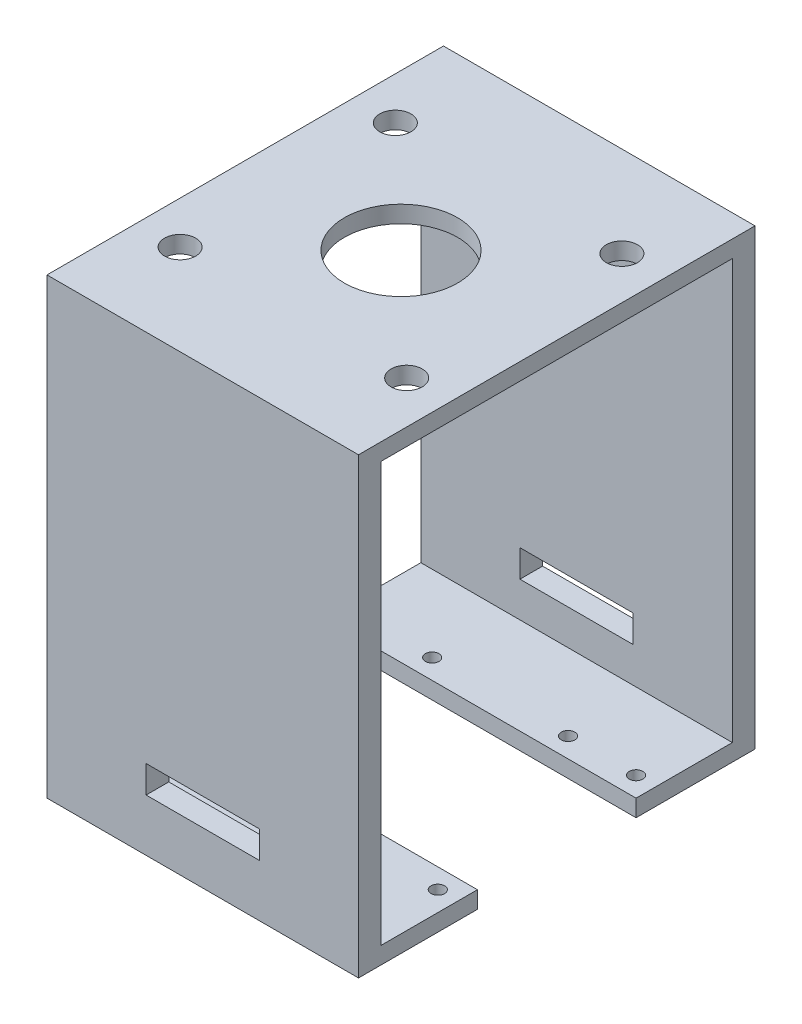
from build123d import *

# Parameters (mm, degrees)
SKETCH1_W                 = 75
SKETCH1_H                 = 40
SKETCH1_R                 = 5
SKETCH1_R_2               = 1.7
SKETCH1_W_2               = 10
SKETCH1_H_2               = 20
BOSS_EXTRUDE1_DEPTH       = 3
CUT_EXTRUDE1_DEPTH        = 43.605750786
CUT_EXTRUDE1_DEPTH_BACK   = 43.605750786
SKETCH2_W                 = 67
SKETCH2_H                 = 28
BOSS_EXTRUDE3_DEPTH       = 110
BOSS_EXTRUDE3_DEPTH_BACK  = 3
SKETCH3_W                 = 75
SKETCH3_H                 = 70
SKETCH3_W_2               = 67
SKETCH3_H_2               = 40
SKETCH6_W                 = 67
SKETCH6_H                 = 11
CUT_EXTRUDE4_DEPTH        = 122.372360939
SKETCH7_W                 = 70
SKETCH7_H                 = 37
BOSS_EXTRUDE4_DEPTH       = 45
SKETCH8_W                 = 45
SKETCH8_H                 = 62
CUT_EXTRUDE6_DEPTH        = 29
SKETCH11_W                = 45
SKETCH11_H                = 4
CUT_EXTRUDE9_DEPTH        = 157.445677473
SKETCH9_W                 = 38
SKETCH9_H                 = 28.5
CUT_EXTRUDE10_DEPTH       = 204.024629048
SKETCH13_W                = 5
SKETCH13_H                = 38
BOSS_EXTRUDE5_DEPTH       = 32
SKETCH14_R                = 5
SKETCH14_R_2              = 1.7
CUT_EXTRUDE11_DEPTH       = 32
SKETCH15_W                = 165
SKETCH15_H                = 70
SKETCH15_W_2              = 157
SKETCH15_H_2              = 62
BOSS_EXTRUDE6_DEPTH       = 3
SKETCH16_W                = 20
SKETCH16_H                = 4.820648258
CUT_EXTRUDE12_DEPTH       = 159.626132778
SKETCH18_R                = 5
CUT_EXTRUDE14_DEPTH       = 159.626132778
MIRROR6_COPY_1_SKETCH_W   = 5
MIRROR6_COPY_1_SKETCH_H   = 38
MIRROR6_COPY_1_DEPTH      = 32
MIRROR6_COPY_2_SKETCH_R   = 5
MIRROR6_COPY_2_SKETCH_R_2 = 1.7
MIRROR6_COPY_2_DEPTH      = 32
MIRROR6_COPY_3_SKETCH_W   = 5
MIRROR6_COPY_3_SKETCH_H   = 38
MIRROR6_COPY_3_DEPTH      = 32
MIRROR6_COPY_4_SKETCH_R   = 5
MIRROR6_COPY_4_SKETCH_R_2 = 1.7
MIRROR6_COPY_4_DEPTH      = 32
SKETCH19_W                = 38
SKETCH19_H                = 3.5
CUT_EXTRUDE15_DEPTH       = 10
SKETCH20_R                = 1.2
CUT_EXTRUDE16_DEPTH       = 10
SKETCH21_W                = 10
SKETCH21_H                = 80
CUT_EXTRUDE17_DEPTH       = 184.330984833
SKETCH22_W                = 172.739058827
SKETCH22_H                = 75.843231067
CUT_EXTRUDE18_DEPTH       = 184.330984833
SKETCH23_W                = 55
SKETCH23_H                = 70
BOSS_EXTRUDE7_DEPTH       = 3
SKETCH24_R                = 10
SKETCH24_R_2              = 2.75
CUT_EXTRUDE19_DEPTH       = 3


with BuildPart() as part:
    # Sketch1 → Boss-Extrude1 (new body)
    with BuildSketch(Plane(origin=(0, 0, 0), x_dir=(1, 0, 0), z_dir=(0, 1, 0))):
        Rectangle(SKETCH1_W, SKETCH1_H)
        with Locations((-21, 0)):
            Circle(SKETCH1_R, mode=Mode.SUBTRACT)
        with Locations((-30, 8.25)):
            Circle(SKETCH1_R_2, mode=Mode.SUBTRACT)
        with Locations((-12, 8.25)):
            Circle(SKETCH1_R_2, mode=Mode.SUBTRACT)
        with Locations((-12, -8.25)):
            Circle(SKETCH1_R_2, mode=Mode.SUBTRACT)
        with Locations((-30, -8.25)):
            Circle(SKETCH1_R_2, mode=Mode.SUBTRACT)
        with Locations((12, 8.25)):
            Circle(SKETCH1_R_2, mode=Mode.SUBTRACT)
        with Locations((12, -8.25)):
            Circle(SKETCH1_R_2, mode=Mode.SUBTRACT)
        with Locations((21, 0)):
            Circle(SKETCH1_R, mode=Mode.SUBTRACT)
        with Locations((30, -8.25)):
            Circle(SKETCH1_R_2, mode=Mode.SUBTRACT)
        with Locations((30, 8.25)):
            Circle(SKETCH1_R_2, mode=Mode.SUBTRACT)
        Rectangle(SKETCH1_W_2, SKETCH1_H_2, mode=Mode.SUBTRACT)
    extrude(amount=BOSS_EXTRUDE1_DEPTH)

    # Sketch2 → Cut-Extrude1 (cut, two sides: drawn at the far end of the back side and taken through both)
    with BuildSketch(Plane(origin=(0, 3, 0), x_dir=(1, 0, 0), z_dir=(0, 1, 0)).offset(-CUT_EXTRUDE1_DEPTH_BACK)):
        Rectangle(SKETCH2_W, SKETCH2_H)
    extrude(amount=CUT_EXTRUDE1_DEPTH + CUT_EXTRUDE1_DEPTH_BACK, mode=Mode.SUBTRACT)

    # Sketch3 → Boss-Extrude3 (add, two sides: drawn at the far end of the back side and taken through both)
    with BuildSketch(Plane(origin=(0, 3, 0), x_dir=(1, 0, 0), z_dir=(0, 1, 0)).offset(-BOSS_EXTRUDE3_DEPTH_BACK)):
        Rectangle(SKETCH3_W, SKETCH3_H)
        Rectangle(SKETCH3_W_2, SKETCH3_H_2, mode=Mode.SUBTRACT)
    extrude(amount=BOSS_EXTRUDE3_DEPTH + BOSS_EXTRUDE3_DEPTH_BACK)

    # Sketch6 → Cut-Extrude4 (cut, through all)
    with BuildSketch(Plane(origin=(0, 3, 0), x_dir=(1, 0, 0), z_dir=(0, 1, 0))):
        with Locations((0, -25.5)):
            Rectangle(SKETCH6_W, SKETCH6_H)
        with Locations((0, 25.5)):
            Rectangle(SKETCH6_W, SKETCH6_H)
    extrude(amount=CUT_EXTRUDE4_DEPTH, mode=Mode.SUBTRACT)

    # Sketch7 → Boss-Extrude4 (add)
    with BuildSketch(Plane.ZY.offset(37.5)):
        with Locations((0, 94.5)):
            Rectangle(SKETCH7_W, SKETCH7_H)
    boss_extrude4 = extrude(amount=BOSS_EXTRUDE4_DEPTH)

    # Mirror2: Boss-Extrude4 across plane
    add(boss_extrude4.mirror(Plane(origin=(0, 0, 0), x_dir=(0, 0, 1), z_dir=(1, 0, 0))))

    # Sketch8 → Cut-Extrude6 (cut)
    with BuildSketch(Plane(origin=(0, 113, 0), x_dir=(1, 0, 0), z_dir=(0, 1, 0))):
        with Locations((-56, 0)):
            Rectangle(SKETCH8_W, SKETCH8_H)
        with Locations((56, 0)):
            Rectangle(SKETCH8_W, SKETCH8_H)
    extrude(amount=-CUT_EXTRUDE6_DEPTH, mode=Mode.SUBTRACT)

    # Sketch11 → Cut-Extrude9 (cut, through all)
    with BuildSketch(Plane.XY.offset(35)):
        with Locations((-60, 78)):
            Rectangle(SKETCH11_W, SKETCH11_H)
        with Locations((60, 78)):
            Rectangle(SKETCH11_W, SKETCH11_H)
    extrude(amount=-CUT_EXTRUDE9_DEPTH, mode=Mode.SUBTRACT)

    # Sketch9 → Cut-Extrude10 (cut, through all)
    with BuildSketch(Plane.ZY.offset(82.5)):
        with Locations((0, 98.25)):
            Rectangle(SKETCH9_W, SKETCH9_H)
    extrude(amount=-CUT_EXTRUDE10_DEPTH, mode=Mode.SUBTRACT)

    # Sketch13 → Boss-Extrude5 (add)
    with BuildSketch(Plane(origin=(0, 84, 0), x_dir=(1, 0, 0), z_dir=(0, 1, 0))):
        with Locations((-54.5, 0)):
            Rectangle(SKETCH13_W, SKETCH13_H)
    boss_extrude5 = extrude(amount=BOSS_EXTRUDE5_DEPTH)

    # Sketch14 → Cut-Extrude11 (cut)
    with BuildSketch(Plane.ZY.offset(57)):
        with Locations((0, 98.25)):
            Circle(SKETCH14_R)
        with Locations((-9, 106.5)):
            Circle(SKETCH14_R_2)
        with Locations((9, 106.5)):
            Circle(SKETCH14_R_2)
        with Locations((9, 90)):
            Circle(SKETCH14_R_2)
        with Locations((-9, 90)):
            Circle(SKETCH14_R_2)
    cut_extrude11 = extrude(amount=-CUT_EXTRUDE11_DEPTH, mode=Mode.SUBTRACT)

    # Mirror4: Boss-Extrude5, Cut-Extrude11 across plane
    add(boss_extrude5.mirror(Plane(origin=(0, 0, 0), x_dir=(0, 0, 1), z_dir=(1, 0, 0))))
    add(cut_extrude11.mirror(Plane(origin=(0, 0, 0), x_dir=(0, 0, 1), z_dir=(1, 0, 0))), mode=Mode.SUBTRACT)

    # Sketch15 → Boss-Extrude6 (add)
    with BuildSketch(Plane(origin=(0, 113, 0), x_dir=(1, 0, 0), z_dir=(0, 1, 0))):
        Rectangle(SKETCH15_W, SKETCH15_H)
        Rectangle(SKETCH15_W_2, SKETCH15_H_2, mode=Mode.SUBTRACT)
    extrude(amount=BOSS_EXTRUDE6_DEPTH)

    # Sketch16 → Cut-Extrude12 (cut, through all)
    with BuildSketch(Plane.XY.offset(35)):
        with Locations((0, 11.636111214)):
            Rectangle(SKETCH16_W, SKETCH16_H)
    extrude(amount=-CUT_EXTRUDE12_DEPTH, mode=Mode.SUBTRACT)

    # Sketch18 → Cut-Extrude14 (cut, through all)
    with BuildSketch(Plane.XY.offset(35)):
        with Locations((67.75, 100)):
            Circle(SKETCH18_R)
    cut_extrude14 = extrude(amount=-CUT_EXTRUDE14_DEPTH, mode=Mode.SUBTRACT)

    # Mirror5: Cut-Extrude14 across plane
    add(cut_extrude14.mirror(Plane(origin=(0, 0, 0), x_dir=(0, 0, 1), z_dir=(1, 0, 0))), mode=Mode.SUBTRACT)

    # Mirror6 copy 1 sketch → Mirror6 copy 1 (add)
    with BuildSketch(Plane(origin=(0, 148, 0), x_dir=(-1, 0, 0), z_dir=(0, -1, 0))):
        with Locations((-54.5, 0)):
            Rectangle(MIRROR6_COPY_1_SKETCH_W, MIRROR6_COPY_1_SKETCH_H)
    extrude(amount=MIRROR6_COPY_1_DEPTH)

    # Mirror6 copy 2 sketch → Mirror6 copy 2 (cut)
    with BuildSketch(Plane(origin=(57, 232, 0), x_dir=(0, 0, 1), z_dir=(1, 0, 0))):
        with Locations((0, 98.25)):
            Circle(MIRROR6_COPY_2_SKETCH_R)
        with Locations((-9, 106.5)):
            Circle(MIRROR6_COPY_2_SKETCH_R_2)
        with Locations((9, 106.5)):
            Circle(MIRROR6_COPY_2_SKETCH_R_2)
        with Locations((9, 90)):
            Circle(MIRROR6_COPY_2_SKETCH_R_2)
        with Locations((-9, 90)):
            Circle(MIRROR6_COPY_2_SKETCH_R_2)
    extrude(amount=-MIRROR6_COPY_2_DEPTH, mode=Mode.SUBTRACT)

    # Mirror6 copy 3 sketch → Mirror6 copy 3 (add)
    with BuildSketch(Plane.XZ.offset(-148)):
        with Locations((-54.5, 0)):
            Rectangle(MIRROR6_COPY_3_SKETCH_W, MIRROR6_COPY_3_SKETCH_H)
    extrude(amount=MIRROR6_COPY_3_DEPTH)

    # Mirror6 copy 4 sketch → Mirror6 copy 4 (cut)
    with BuildSketch(Plane(origin=(-57, 232, 0), x_dir=(0, 0, 1), z_dir=(-1, 0, 0))):
        with Locations((0, -98.25)):
            Circle(MIRROR6_COPY_4_SKETCH_R)
        with Locations((-9, -106.5)):
            Circle(MIRROR6_COPY_4_SKETCH_R_2)
        with Locations((9, -106.5)):
            Circle(MIRROR6_COPY_4_SKETCH_R_2)
        with Locations((9, -90)):
            Circle(MIRROR6_COPY_4_SKETCH_R_2)
        with Locations((-9, -90)):
            Circle(MIRROR6_COPY_4_SKETCH_R_2)
    extrude(amount=-MIRROR6_COPY_4_DEPTH, mode=Mode.SUBTRACT)

    # Sketch19 → Cut-Extrude15 (cut)
    with BuildSketch(Plane(origin=(82.5, 0, 0), x_dir=(0, 0, -1), z_dir=(1, 0, 0))):
        with Locations((0, 114.25)):
            Rectangle(SKETCH19_W, SKETCH19_H)
    cut_extrude15 = extrude(amount=-CUT_EXTRUDE15_DEPTH, mode=Mode.SUBTRACT)

    # Mirror7: Cut-Extrude15 across plane
    add(cut_extrude15.mirror(Plane(origin=(0, 0, 0), x_dir=(0, 0, 1), z_dir=(1, 0, 0))), mode=Mode.SUBTRACT)

    # Sketch20 → Cut-Extrude16 (cut)
    with BuildSketch(Plane(origin=(0, 3, 0), x_dir=(1, 0, 0), z_dir=(0, 1, 0))):
        with Locations((-12, 17.5)):
            Circle(SKETCH20_R)
        with Locations((-12, -17.5)):
            Circle(SKETCH20_R)
        with Locations((-24, -17.5)):
            Circle(SKETCH20_R)
        with Locations((-24, 17.5)):
            Circle(SKETCH20_R)
        with Locations((12, -17.5)):
            Circle(SKETCH20_R)
        with Locations((24, -17.5)):
            Circle(SKETCH20_R)
        with Locations((12, 17.5)):
            Circle(SKETCH20_R)
        with Locations((24, 17.5)):
            Circle(SKETCH20_R)
    extrude(amount=-CUT_EXTRUDE16_DEPTH, mode=Mode.SUBTRACT)

    # Sketch21 → Cut-Extrude17 (cut, through all)
    with BuildSketch(Plane.XY.offset(35)):
        with Locations((32.5, 40)):
            Rectangle(SKETCH21_W, SKETCH21_H)
        with Locations((-32.5, 40)):
            Rectangle(SKETCH21_W, SKETCH21_H)
    extrude(amount=-CUT_EXTRUDE17_DEPTH, mode=Mode.SUBTRACT)

    # Sketch22 → Cut-Extrude18 (cut, through all)
    with BuildSketch(Plane.XY.offset(35)):
        with Locations((-3.869529414, 117.921615534)):
            Rectangle(SKETCH22_W, SKETCH22_H)
    extrude(amount=-CUT_EXTRUDE18_DEPTH, mode=Mode.SUBTRACT)


with BuildPart() as cut_extrude18_piece_1:
    # of the separate pieces the step leaves, piece 1, a body of its own (cut_extrude18_pieces)
    add(part.part.solids().sort_by_distance((-27.5, 0, 35))[0])



with BuildPart() as cut_extrude18_piece_2:
    # of the separate pieces the step leaves, piece 2, a body of its own (cut_extrude18_pieces)
    add(part.part.solids().sort_by_distance((27.5, 0, -35))[0])


with BuildPart() as cut_extrude18_piece_1_1:
    add(cut_extrude18_piece_1.part)

    add(cut_extrude18_piece_2.part)  # Boss-Extrude7 merges Cut-Extrude18 piece 2
    # Sketch23 → Boss-Extrude7 (add)
    with BuildSketch(Plane(origin=(0, 80, 0), x_dir=(1, 0, 0), z_dir=(0, 1, 0))):
        Rectangle(SKETCH23_W, SKETCH23_H)
    extrude(amount=-BOSS_EXTRUDE7_DEPTH)

    # Sketch24 → Cut-Extrude19 (cut)
    with BuildSketch(Plane(origin=(0, 80, 0), x_dir=(1, 0, 0), z_dir=(0, 1, 0))):
        Circle(SKETCH24_R)
        with Locations((-20, 19)):
            Circle(SKETCH24_R_2)
        with Locations((-20, -19)):
            Circle(SKETCH24_R_2)
        with Locations((20, -19)):
            Circle(SKETCH24_R_2)
        with Locations((20, 19)):
            Circle(SKETCH24_R_2)
    extrude(amount=-CUT_EXTRUDE19_DEPTH, mode=Mode.SUBTRACT)


solid = cut_extrude18_piece_1_1.part
